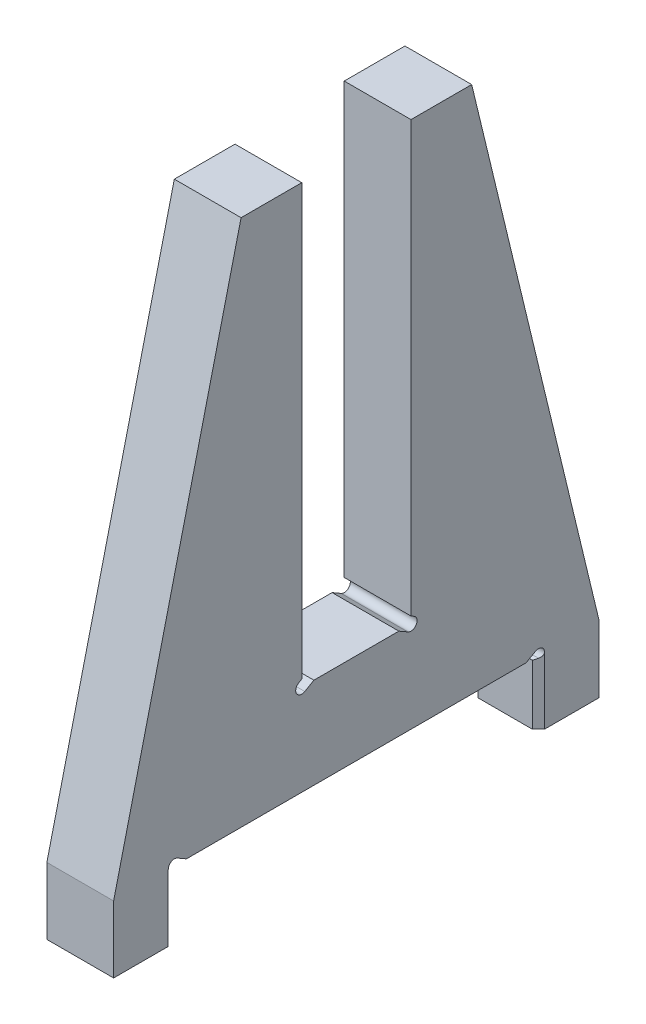
from build123d import *

# Parameters (mm, degrees)
BOSS_EXTRUDE1_DEPTH = 11
CHAMFER4_SIZE       = 1
CHAMFER5_SIZE       = 1


with BuildPart() as part:
    # Sketch1 → Boss-Extrude1 (new body)
    with BuildSketch(Plane(origin=(0, 0, 0), x_dir=(0, 0, -1), z_dir=(1, 0, 0))):
        with BuildLine():
            Line((28, 1.391885412), (-28, 1.391885412))
            Line((-28, 1.391885412), (-29.5, 2.257910816))
            ThreePointArc((-29.5, 2.257910816), (-30.866025404, 1.891885412), (-30.5, 0.525860008))
            Line((-30.5, 0.525860008), (-30, 0.237184874))
            Line((-30, 0.237184874), (-30, -9.608114588))
            Line((-30, -9.608114588), (-40, -9.608114588))
            Line((-40, -9.608114588), (-40, 1.391885412))
            Line((-40, 1.391885412), (-19, 88.391885412))
            Line((-19, 88.391885412), (-9, 88.391885412))
            Line((-9, 88.391885412), (-9, 17.54658595))
            Line((-9, 17.54658595), (-9.5, 17.257910816))
            ThreePointArc((-9.5, 17.257910816), (-9.866025404, 15.891885412), (-8.5, 15.525860008))
            Line((-8.5, 15.525860008), (-7, 16.391885412))
            Line((-7, 16.391885412), (7, 16.391885412))
            Line((7, 16.391885412), (8.5, 15.525860008))
            ThreePointArc((8.5, 15.525860008), (9.866025404, 15.891885412), (9.5, 17.257910816))
            Line((9.5, 17.257910816), (9, 17.54658595))
            Line((9, 17.54658595), (9, 88.391885412))
            Line((9, 88.391885412), (19, 88.391885412))
            Line((19, 88.391885412), (40, 1.391885412))
            Line((40, 1.391885412), (40, -9.608114588))
            Line((40, -9.608114588), (30, -9.608114588))
            Line((30, -9.608114588), (30, 0.237184874))
            Line((30, 0.237184874), (30.5, 0.525860008))
            ThreePointArc((30.5, 0.525860008), (30.866025404, 1.891885412), (29.5, 2.257910816))
            Line((29.5, 2.257910816), (28, 1.391885412))
        make_face()
    extrude(amount=BOSS_EXTRUDE1_DEPTH)

    # Chamfer4
    chamfer4_edges = [part.edges().sort_by_distance(p)[0] for p in [
        (0, -4.685464857, 30),
        (11, -4.685464857, 30),
    ]]
    chamfer(chamfer4_edges, length=CHAMFER4_SIZE - 0.0001)  # a hair under: the kernel refuses the full size

    # Chamfer5
    chamfer5_edges = [part.edges().sort_by_distance(p)[0] for p in [
        (0, -4.685464857, -30),
        (11, -4.685464857, -30),
    ]]
    chamfer(chamfer5_edges, length=CHAMFER5_SIZE - 0.0001)  # a hair under: the kernel refuses the full size


solid = part.part
